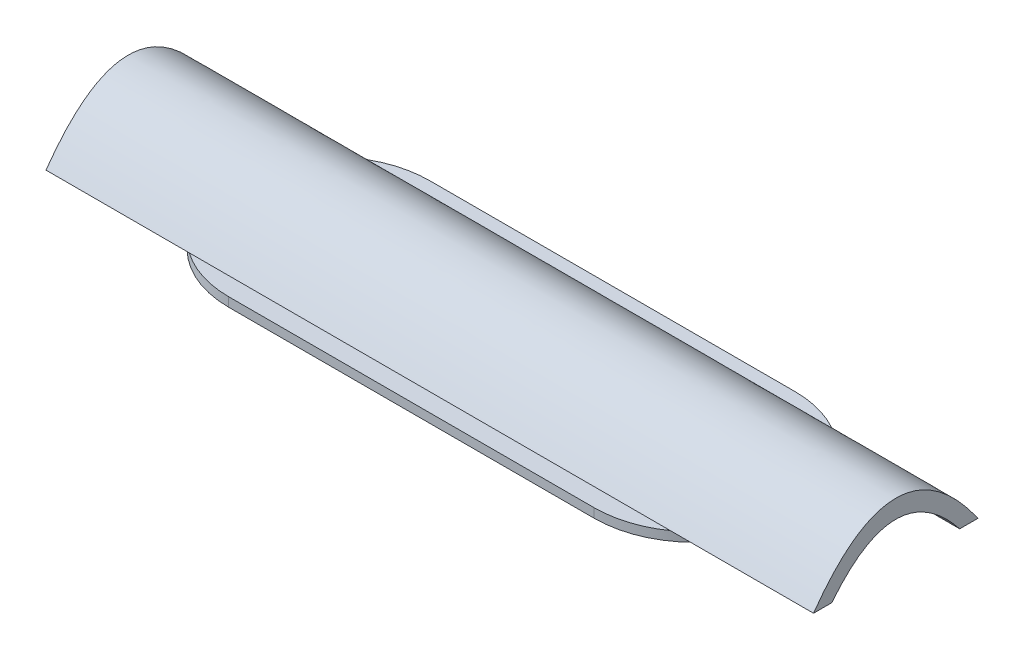
from build123d import *

# Parameters (mm, degrees)
BASE_DEPTH              = 0.5
TOP_DEPTH               = 21
TOP_DEPTH_BACK          = 21
BOSS_EXTRU_1_DEPTH      = 1
BOSS_EXTRU_1_DEPTH_BACK = 0.5


with BuildPart() as part:
    # Esquisse1 → Base (new body)
    with BuildSketch(Plane(origin=(0, 0, 0), x_dir=(1, 0, 0), z_dir=(0, 1, 0))):
        with BuildLine():
            Line((-10, 5.5), (10, 5.5))
            ThreePointArc((10, 5.5), (15.5, 0), (10, -5.5))
            Line((10, -5.5), (-10, -5.5))
            ThreePointArc((-10, -5.5), (-15.5, 0), (-10, 5.5))
        make_face()
        with BuildLine():
            Line((-10, 3.5), (10, 3.5))
            ThreePointArc((10, 3.5), (13.5, 0), (10, -3.5))
            Line((10, -3.5), (-10, -3.5))
            ThreePointArc((-10, -3.5), (-13.5, 0), (-10, 3.5))
        make_face(mode=Mode.SUBTRACT)
    extrude(amount=BASE_DEPTH)

    # Esquisse3 → Top (add, two sides: drawn at the far end of the back side and taken through both)
    with BuildSketch(Plane(origin=(0, 0, 0), x_dir=(0, 0, -1), z_dir=(1, 0, 0)).offset(-TOP_DEPTH_BACK)):
        with BuildLine():
            Line((-4.5, 0.5), (-3.5, 0.5))
            add(Edge.make_bspline(
                [(-3.5, 0.5), (-0.000733786, 4.90672822), (3.5, 0.5)],
                knots=[0, 0, 0, 1, 1, 1], degree=2))
            Line((3.5, 0.5), (4.5, 0.5))
            add(Edge.make_bspline(
                [(-4.5, 0.5), (0.010455594, 6.906741363), (4.5, 0.5)],
                knots=[0, 0, 0, 1, 1, 1], degree=2))
        make_face()
    extrude(amount=TOP_DEPTH + TOP_DEPTH_BACK)

    # Esquisse5 → Boss.-Extru.1 (add, two sides: drawn at the far end of the back side and taken through both)
    with BuildSketch(Plane.XZ.offset(-BOSS_EXTRU_1_DEPTH_BACK)):
        with BuildLine():
            Line((10, -3.5), (-10, -3.5))
            ThreePointArc((-10, -3.5), (-13.5, 0), (-10, 3.5))
            Line((-10, 3.5), (10, 3.5))
            ThreePointArc((10, 3.5), (13.5, 0), (10, -3.5))
        make_face()
        with BuildLine():
            Line((-10, 2.5), (10, 2.5))
            ThreePointArc((10, 2.5), (12.5, 0), (10, -2.5))
            Line((10, -2.5), (-10, -2.5))
            ThreePointArc((-10, -2.5), (-12.5, 0), (-10, 2.5))
        make_face(mode=Mode.SUBTRACT)
    extrude(amount=BOSS_EXTRU_1_DEPTH + BOSS_EXTRU_1_DEPTH_BACK)


solid = part.part
